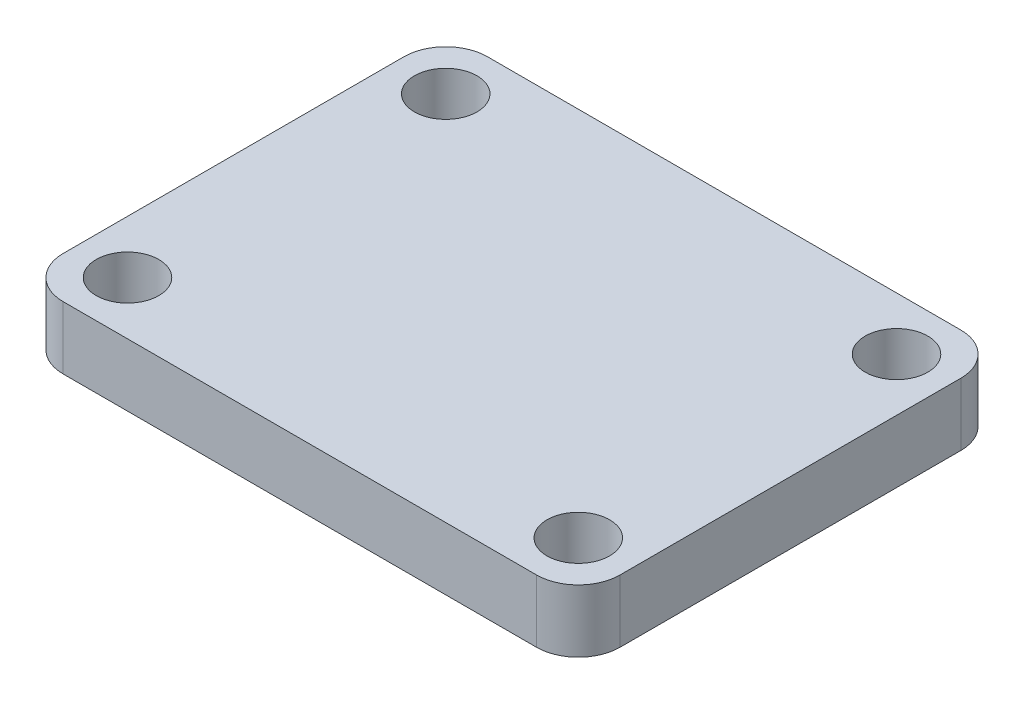
from build123d import *

# Parameters (mm, degrees)
CROQUIS1_W              = 26.67
CROQUIS1_H              = 20.32
SALIENTE_EXTRUIR1_DEPTH = 3
CROQUIS2_R              = 1.5
CORTAR_EXTRUIR1_DEPTH   = 34.662906886
REDONDEO1_R             = 2


with BuildPart() as part:
    # Croquis1 → Saliente-Extruir1 (new body)
    with BuildSketch(Plane(origin=(0, 0, 0), x_dir=(1, 0, 0), z_dir=(0, 1, 0))):
        with Locations((13.335, 10.16)):
            Rectangle(CROQUIS1_W, CROQUIS1_H)
    extrude(amount=SALIENTE_EXTRUIR1_DEPTH)

    # Croquis2 → Cortar-Extruir1 (cut, through all)
    with BuildSketch(Plane(origin=(0, 3, 0), x_dir=(1, 0, 0), z_dir=(0, 1, 0))):
        with Locations((24.13, 2.54)):
            Circle(CROQUIS2_R)
        with Locations((2.54, 2.54)):
            Circle(CROQUIS2_R)
        with Locations((2.54, 17.78)):
            Circle(CROQUIS2_R)
        with Locations((24.13, 17.78)):
            Circle(CROQUIS2_R)
    extrude(amount=-CORTAR_EXTRUIR1_DEPTH, mode=Mode.SUBTRACT)

    # Redondeo1
    redondeo1_edges = [part.edges().sort_by_distance(p)[0] for p in [
        (26.67, 1.5, -20.32),
        (26.67, 1.5, 0),
        (0, 1.5, 0),
        (0, 1.5, -20.32),
    ]]
    fillet(redondeo1_edges, radius=REDONDEO1_R)


solid = part.part
